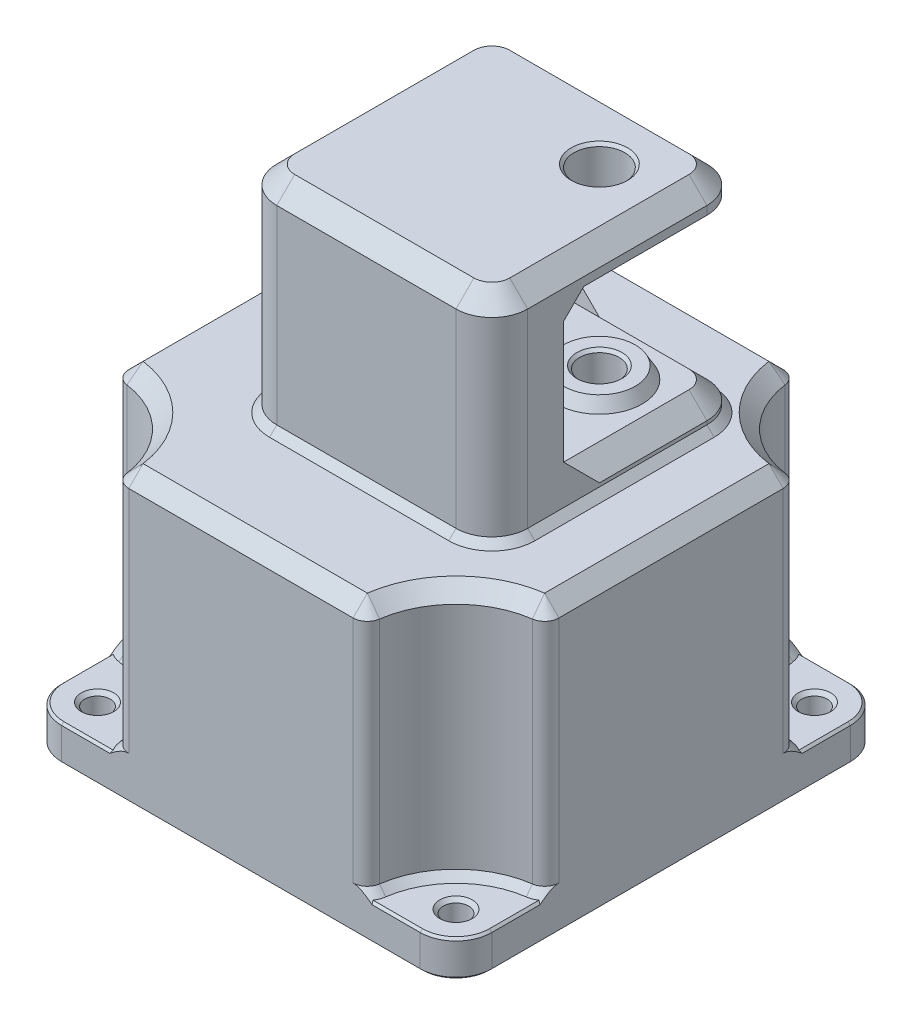
from build123d import *

# Parameters (mm, degrees)
BOSS_EXTRUDE1_DEPTH            = 6.35
BOSS_EXTRUDE7_DEPTH            = 50.8
SKETCH2_W                      = 44.45
SKETCH2_H                      = 44.45
BOSS_EXTRUDE2_DEPTH            = 55.88
BOSS_EXTRUDE3_DEPTH            = 83.82
BOSS_EXTRUDE4_START            = 83.82
SKETCH2_5_W                    = 31.75
SKETCH2_5_H                    = 31.75
SKETCH2_5_R                    = 6.35
BOSS_EXTRUDE4_DEPTH            = 5.08
BOSS_EXTRUDE6_START            = 81.699999938
SKETCH2_7_R                    = 6.35
BOSS_EXTRUDE6_DEPTH            = 2.120000062
BOSS_EXTRUDE6_DRAFT            = -30
F_8_CLEARANCE_HOLE1_AT_2_COUNT = 2
F_8_CLEARANCE_HOLE1_AT_2_PITCH = 63.5
F_8_CLEARANCE_HOLE1_AT_3_COUNT = 2
F_8_CLEARANCE_HOLE1_AT_3_PITCH = 89.802561211
F_8_CLEARANCE_HOLE1_AT_4_COUNT = 2
F_8_CLEARANCE_HOLE1_AT_4_PITCH = 63.5
FILLET2_R                      = 6.35
FILLET4_R                      = 2.54
CHAMFER2_SIZE                  = 3.175
CHAMFER3_SIZE                  = 3.175
CHAMFER5_SIZE                  = 1.27
CHAMFER6_SIZE                  = 2.54
CHAMFER7_SIZE                  = 1.27
CHAMFER4_SIZE                  = 0.396875


# Read off the part's stored shape, not the designer's step: Folder2___EndTag___
# Some blends are built 0.0001 mm under size
with BuildPart() as part:
    # Sketch1 → Boss-Extrude1 (new body)
    with BuildSketch(Plane(origin=(0, 0, 0), x_dir=(1, 0, 0), z_dir=(0, 1, 0))):
        with BuildLine():
            Line((-38.1, -22.225), (-38.1, -38.1))
            Line((-38.1, -38.1), (-22.225, -38.1))
            ThreePointArc((-22.225, -38.1), (-26.874679849, -26.874679849), (-38.1, -22.225))
        make_face()
        with BuildLine():
            ThreePointArc((-38.1, -22.225), (-26.874679849, -26.874679849), (-22.225, -38.1))
            Line((-22.225, -38.1), (22.225, -38.1))
            ThreePointArc((22.225, -38.1), (26.874679849, -26.874679849), (38.1, -22.225))
            Line((38.1, -22.225), (38.1, 22.225))
            ThreePointArc((38.1, 22.225), (26.874679849, 26.874679849), (22.225, 38.1))
            Line((22.225, 38.1), (-22.225, 38.1))
            ThreePointArc((-22.225, 38.1), (-26.874679849, 26.874679849), (-38.1, 22.225))
            Line((-38.1, 22.225), (-38.1, -22.225))
        make_face()
        with BuildLine():
            Line((-38.1, 38.1), (-38.1, 22.225))
            ThreePointArc((-38.1, 22.225), (-26.874679849, 26.874679849), (-22.225, 38.1))
            Line((-22.225, 38.1), (-38.1, 38.1))
        make_face()
        with BuildLine():
            ThreePointArc((22.225, 38.1), (26.874679849, 26.874679849), (38.1, 22.225))
            Line((38.1, 22.225), (38.1, 38.1))
            Line((38.1, 38.1), (22.225, 38.1))
        make_face()
        with BuildLine():
            ThreePointArc((38.1, -22.225), (26.874679849, -26.874679849), (22.225, -38.1))
            Line((22.225, -38.1), (38.1, -38.1))
            Line((38.1, -38.1), (38.1, -22.225))
        make_face()
    extrude(amount=BOSS_EXTRUDE1_DEPTH)

    # Sketch1<3> → Boss-Extrude7 (add)
    with BuildSketch(Plane(origin=(0, 0, 0), x_dir=(1, 0, 0), z_dir=(0, 1, 0))):
        with BuildLine():
            ThreePointArc((-38.1, -22.225), (-26.874679849, -26.874679849), (-22.225, -38.1))
            Line((-22.225, -38.1), (22.225, -38.1))
            ThreePointArc((22.225, -38.1), (26.874679849, -26.874679849), (38.1, -22.225))
            Line((38.1, -22.225), (38.1, 22.225))
            ThreePointArc((38.1, 22.225), (26.874679849, 26.874679849), (22.225, 38.1))
            Line((22.225, 38.1), (-22.225, 38.1))
            ThreePointArc((-22.225, 38.1), (-26.874679849, 26.874679849), (-38.1, 22.225))
            Line((-38.1, 22.225), (-38.1, -22.225))
        make_face()
    extrude(amount=BOSS_EXTRUDE7_DEPTH)

    # Sketch2 → Boss-Extrude2 (add)
    with BuildSketch(Plane(origin=(0, 0, 0), x_dir=(1, 0, 0), z_dir=(0, 1, 0))):
        with Locations((3.175, 3.175)):
            Rectangle(SKETCH2_W, SKETCH2_H)
    extrude(amount=BOSS_EXTRUDE2_DEPTH)

    # Sketch2<3> → Boss-Extrude3 (add)
    with BuildSketch(Plane(origin=(0, 0, 0), x_dir=(1, 0, 0), z_dir=(0, 1, 0))):
        Polygon((-19.05, 25.4), (-19.05, -19.05), (25.4, -19.05), (25.4, -6.35), (-6.35, -6.35), (-6.35, 25.4), align=None)
    extrude(amount=BOSS_EXTRUDE3_DEPTH)

    # Sketch2<5> → Boss-Extrude4 (add)
    # profile 1 of 3: a face of its own
    with BuildSketch(Plane(origin=(0, 0, 0), x_dir=(1, 0, 0), z_dir=(0, 1, 0)).offset(BOSS_EXTRUDE4_START)):
        Polygon((-19.05, 25.4), (-19.05, -19.05), (25.4, -19.05), (25.4, -6.35), (-6.35, -6.35), (-6.35, 25.4), align=None)
    # profile 2 of 3: a face of its own
    with BuildSketch(Plane(origin=(0, 0, 0), x_dir=(1, 0, 0), z_dir=(0, 1, 0)).offset(BOSS_EXTRUDE4_START)):
        with Locations((9.525, 9.525)):
            Rectangle(SKETCH2_5_W, SKETCH2_5_H)
        with Locations((12.7, 12.7)):
            Circle(SKETCH2_5_R, mode=Mode.SUBTRACT)
    # profile 3 of 3: a face of its own
    with BuildSketch(Plane(origin=(0, 0, 0), x_dir=(1, 0, 0), z_dir=(0, 1, 0)).offset(BOSS_EXTRUDE4_START)):
        with Locations((12.7, 12.7)):
            Circle(SKETCH2_5_R)
    extrude(amount=BOSS_EXTRUDE4_DEPTH)

    # Boss-Extrude5 outline → Boss-Extrude5 (revolve)
    with BuildSketch(Plane(origin=(12.7, 0, -12.7), x_dir=(1, 0, 0), z_dir=(0, 0, 1))):
        Polygon((6.35, 58.000000062), (0, 58.000000062), (0, 55.88), (7.573982606, 55.88), align=None)
    revolve(axis=Axis((12.7, 0, -12.7), (0, 1, 0)))


with BuildPart() as boss_extrude6_tool:
    # Sketch2<7> → Boss-Extrude6 (with draft: the straight prism first)
    with BuildSketch(Plane(origin=(0, 0, 0), x_dir=(1, 0, 0), z_dir=(0, 1, 0)).offset(BOSS_EXTRUDE6_START)):
        with Locations((12.7, 12.7)):
            Circle(SKETCH2_7_R)
    extrude(amount=BOSS_EXTRUDE6_DEPTH)
    # Boss-Extrude6: the draft: its side faces are tilted about the plane it starts from
    boss_extrude6_sides = [boss_extrude6_tool.faces().sort_by_distance(p)[0] for p in [
        (6.35, 82.759999969, -12.7),
    ]]
    draft(boss_extrude6_sides, Plane(origin=(0, 0, 0), x_dir=(1, 0, 0), z_dir=(0, 1, 0)).offset(BOSS_EXTRUDE6_START), BOSS_EXTRUDE6_DRAFT)


with BuildPart() as part_1:
    add(part.part)

    # Boss-Extrude6: add boss_extrude6_tool
    add(boss_extrude6_tool.part)

    # Sketch5 → Ø7.0 (7) Diameter Hole1 (revolve, cut)
    with BuildSketch(Plane(origin=(12.7, 58.000000062, -12.7), x_dir=(0, 0, 1), z_dir=(1, 0, 0))):
        Polygon((0, 0), (0, 58.000000062), (4, 58.000000062), (3.5, 57.500000062), (3.5, 0.5), (4, 0), align=None)
    revolve(axis=Axis((12.7, 64.350000062, -12.7), (0, -1, 0)), mode=Mode.SUBTRACT)

    # Sketch8 → M8 Clearance Hole1 (revolve, cut)
    with BuildSketch(Plane(origin=(12.7, 81.699999938, -12.7), x_dir=(0, 0, -1), z_dir=(1, 0, 0))):
        Polygon((0, 0), (0, 7.200000062), (5, 7.200000062), (4.5, 6.700000062), (4.5, 0.5), (5, 0), align=None)
    revolve(axis=Axis((12.7, 75.349999938, -12.7), (0, 1, 0)), mode=Mode.SUBTRACT)

    # Sketch17 → #8 Clearance Hole1 (revolve, cut)
    with BuildSketch(Plane(origin=(-31.75, 6.35, -31.75), x_dir=(0, 0, 1), z_dir=(1, 0, 0))):
        Polygon((0, 0), (0, 6.35), (2.8829, 6.35), (2.2479, 5.715), (2.2479, 0.635), (2.8829, 0), align=None)
    f_8_clearance_hole1 = revolve(axis=Axis((-31.75, 12.7, -31.75), (0, -1, 0)), mode=Mode.SUBTRACT)

    # #8 Clearance Hole1 at 2: #8 Clearance Hole1 ×2
    with Locations(*[(i * F_8_CLEARANCE_HOLE1_AT_2_PITCH, 0, 0) for i in range(1, F_8_CLEARANCE_HOLE1_AT_2_COUNT)]):
        add(f_8_clearance_hole1, mode=Mode.SUBTRACT)

    # #8 Clearance Hole1 at 3: #8 Clearance Hole1 ×2
    with Locations(*[Vector(0.7071067811865476, 0, 0.7071067811865476) * (i * F_8_CLEARANCE_HOLE1_AT_3_PITCH) for i in range(1, F_8_CLEARANCE_HOLE1_AT_3_COUNT)]):
        add(f_8_clearance_hole1, mode=Mode.SUBTRACT)

    # #8 Clearance Hole1 at 4: #8 Clearance Hole1 ×2
    with Locations(*[(0, 0, i * F_8_CLEARANCE_HOLE1_AT_4_PITCH) for i in range(1, F_8_CLEARANCE_HOLE1_AT_4_COUNT)]):
        add(f_8_clearance_hole1, mode=Mode.SUBTRACT)

    # Fillet2
    fillet2_edges = [part_1.edges().sort_by_distance(p)[0] for p in [
        (-6.35, 69.85, 6.35),
        (-38.1, 3.175, 38.1),
        (-38.1, 3.175, -38.1),
        (38.1, 3.175, -38.1),
        (38.1, 3.175, 38.1),
        (25.4, 86.36, -25.4),
        (25.4, 53.34, -25.4),
        (-19.05, 69.85, -25.4),
        (-19.05, 69.85, 19.05),
        (25.4, 69.85, 19.05),
    ]]
    fillet(fillet2_edges, radius=FILLET2_R)

    # Fillet4
    fillet4_edges = [part_1.edges().sort_by_distance(p)[0] for p in [
        (-22.225, 28.575, 38.1),
        (22.225, 28.575, 38.1),
        (38.1, 28.575, 22.225),
        (38.1, 28.575, -22.225),
        (22.225, 28.575, -38.1),
        (-22.225, 28.575, -38.1),
        (-38.1, 28.575, -22.225),
        (-38.1, 28.575, 22.225),
    ]]
    fillet(fillet4_edges, radius=FILLET4_R)

    # Chamfer2
    chamfer2_edges = [part_1.edges().sort_by_distance(p)[0] for p in [
        (-6.35, 83.82, -12.7),
        (12.7, 83.82, 6.35),
        (-6.35, 55.88, -12.7),
        (12.7, 55.88, 6.35),
        (-4.490128061, 55.88, 4.490128061),
        (-4.490128061, 83.82, 4.490128061),
    ]]
    chamfer(chamfer2_edges, length=CHAMFER2_SIZE)

    # Chamfer3
    chamfer3_edges = [part_1.edges().sort_by_distance(p)[0] for p in [
        (23.540128061, 55.88, -23.540128061),
        (3.175, 88.9, -25.4),
        (25.4, 88.9, -3.175),
        (-19.05, 88.9, -3.175),
        (3.175, 88.9, 19.05),
        (23.540128061, 88.9, 17.190128061),
        (-17.190128061, 88.9, 17.190128061),
        (-17.190128061, 88.9, -23.540128061),
        (23.540128061, 88.9, -23.540128061),
        (25.4, 55.88, -7.9375),
        (7.9375, 55.88, -25.4),
    ]]
    chamfer(chamfer3_edges, length=CHAMFER3_SIZE)

    # Chamfer5
    chamfer5_edges = [part_1.edges().sort_by_distance(p)[0] for p in [
        (3.175, 50.8, -25.4),
        (25.4, 50.8, -3.175),
        (-19.05, 50.8, -3.175),
        (3.175, 50.8, 19.05),
        (-17.190128061, 50.8, -23.540128061),
        (23.540128061, 50.8, -23.540128061),
        (-17.190128061, 50.8, 17.190128061),
        (23.540128061, 50.8, 17.190128061),
    ]]
    chamfer(chamfer5_edges, length=CHAMFER5_SIZE)

    # Chamfer6
    chamfer6_edges = [part_1.edges().sort_by_distance(p)[0] for p in [
        (-38.1, 50.8, 0),
        (-26.874679849, 50.8, -26.874679849),
        (0, 50.8, 38.1),
        (26.874679849, 50.8, 26.874679849),
        (38.1, 50.8, 0),
        (26.874679849, 50.8, -26.874679849),
        (0, 50.8, -38.1),
        (-26.874679849, 50.8, 26.874679849),
        (21.528605295, 50.8, 37.475916995),
        (37.475916995, 50.8, 21.528605295),
        (37.475916995, 50.8, -21.528605295),
        (21.528605295, 50.8, -37.475916995),
        (-21.528605295, 50.8, 37.475916995),
        (-37.475916995, 50.8, 21.528605295),
        (-21.528605295, 50.8, -37.475916995),
        (-37.475916995, 50.8, -21.528605295),
    ]]
    chamfer(chamfer6_edges, length=CHAMFER6_SIZE - 0.0001)  # a hair under: the kernel refuses the full size

    # Chamfer7
    # the kernel refuses this chamfer: 1.27 mm, written as the material it adds along each edge
    with BuildSketch(Plane(origin=(-38.1, 6.35, -38.1), x_dir=(0.9904418356100051, 0, 0.1379310344827576), z_dir=(0.1379310344827576, 0, -0.9904418356100051))) as chamfer7_piece_1:
        Polygon((15.875, -CHAMFER7_SIZE), (15.875 - CHAMFER7_SIZE, 0), (15.875, 0), align=None)
    revolve(axis=Axis((-38.1, 6.35, -38.1), (0, -1, 0)), revolution_arc=74.143716468)
    with BuildSketch(Plane(origin=(-38.1, 6.35, 38.1), x_dir=(0.13793103448275934, 0, -0.9904418356100048), z_dir=(-0.9904418356100048, 0, -0.13793103448275934))) as chamfer7_piece_2:
        Polygon((15.875, -CHAMFER7_SIZE), (15.875 - CHAMFER7_SIZE, 0), (15.875, 0), align=None)
    revolve(axis=Axis((-38.1, 6.35, 38.1), (0, -1, 0)), revolution_arc=74.143716468)
    with BuildSketch(Plane(origin=(38.1, 6.35, -38.1), x_dir=(-0.13793103448275804, 0, 0.990441835610005), z_dir=(0.990441835610005, 0, 0.13793103448275804))) as chamfer7_piece_3:
        Polygon((15.875, -CHAMFER7_SIZE), (15.875 - CHAMFER7_SIZE, 0), (15.875, 0), align=None)
    revolve(axis=Axis((38.1, 6.35, -38.1), (0, -1, 0)), revolution_arc=74.143716468)
    with BuildSketch(Plane(origin=(38.1, 6.35, 38.1), x_dir=(-0.9904418356100045, 0, -0.13793103448276064), z_dir=(-0.13793103448276064, 0, 0.9904418356100045))) as chamfer7_piece_4:
        Polygon((15.875, -CHAMFER7_SIZE), (15.875 - CHAMFER7_SIZE, 0), (15.875, 0), align=None)
    revolve(axis=Axis((38.1, 6.35, 38.1), (0, -1, 0)), revolution_arc=74.143716468)
    with BuildSketch(Plane(origin=(-35.56, 6.35, -19.861013597), x_dir=(-0.28070188278331787, 0, 0.9597950057183569), z_dir=(0.9597950057183569, 0, 0.28070188278331787))) as chamfer7_piece_5_section:
        Polygon((2.54, -CHAMFER7_SIZE), (2.54 + CHAMFER7_SIZE, 0), (2.54, 0), align=None)
    chamfer7_piece_5 = revolve(axis=Axis((-35.56, 6.35, -19.861013597), (0, -1, 0)), revolution_arc=155.769758511, mode=Mode.PRIVATE)
    chamfer7_piece_5 = split(chamfer7_piece_5, bisect_by=Plane(origin=(-38.1, 6.867943866, -21.668260247), z_dir=(1, 0, 0)), keep=Keep.TOP, mode=Mode.PRIVATE)
    add(chamfer7_piece_5)
    with BuildSketch(Plane(origin=(-19.861013597, 6.35, -35.56), x_dir=(-0.9904418356100047, 0, -0.1379310344827609), z_dir=(-0.1379310344827609, 0, 0.9904418356100047))) as chamfer7_piece_6_section:
        Polygon((2.54, -CHAMFER7_SIZE), (2.54 + CHAMFER7_SIZE, 0), (2.54, 0), align=None)
    chamfer7_piece_6 = revolve(axis=Axis((-19.861013597, 6.35, -35.56), (0, -1, 0)), revolution_arc=155.769758511, mode=Mode.PRIVATE)
    chamfer7_piece_6 = split(chamfer7_piece_6, bisect_by=Plane(origin=(-21.668259491, 6.867943351, -38.1), z_dir=(0, 0, 1)), keep=Keep.TOP, mode=Mode.PRIVATE)
    add(chamfer7_piece_6)
    with BuildSketch(Plane(origin=(-35.56, 6.35, 19.861013597), x_dir=(-0.28070188278331787, 0, -0.9597950057183569), z_dir=(0.9597950057183569, 0, -0.28070188278331787))) as chamfer7_piece_7_section:
        Polygon((2.54, CHAMFER7_SIZE), (2.54 + CHAMFER7_SIZE, 0), (2.54, 0), align=None)
    chamfer7_piece_7 = revolve(axis=Axis((-35.56, 6.35, 19.861013597), (0, 1, 0)), revolution_arc=155.769758511, mode=Mode.PRIVATE)
    chamfer7_piece_7 = split(chamfer7_piece_7, bisect_by=Plane(origin=(-38.1, 6.867944302, 21.668259037), z_dir=(1, 0, 0)), keep=Keep.TOP, mode=Mode.PRIVATE)
    add(chamfer7_piece_7)
    with BuildSketch(Plane(origin=(-19.861013597, 6.35, 35.56), x_dir=(-0.9904418356100043, 0, 0.13793103448276364), z_dir=(-0.13793103448276364, 0, -0.9904418356100043))) as chamfer7_piece_8_section:
        Polygon((2.54, CHAMFER7_SIZE), (2.54 + CHAMFER7_SIZE, 0), (2.54, 0), align=None)
    chamfer7_piece_8 = revolve(axis=Axis((-19.861013597, 6.35, 35.56), (0, 1, 0)), revolution_arc=155.769758511, mode=Mode.PRIVATE)
    chamfer7_piece_8 = split(chamfer7_piece_8, bisect_by=Plane(origin=(-21.668260079, 6.867943912, 38.1), z_dir=(0, 0, -1)), keep=Keep.TOP, mode=Mode.PRIVATE)
    add(chamfer7_piece_8)
    with BuildSketch(Plane(origin=(19.861013597, 6.35, -35.56), x_dir=(-0.9597950057183566, 0, -0.2807018827833178), z_dir=(-0.2807018827833178, 0, 0.9597950057183566))) as chamfer7_piece_9_section:
        Polygon((2.54, -CHAMFER7_SIZE), (2.54 + CHAMFER7_SIZE, 0), (2.54, 0), align=None)
    chamfer7_piece_9 = revolve(axis=Axis((19.861013597, 6.35, -35.56), (0, -1, 0)), revolution_arc=155.769758511, mode=Mode.PRIVATE)
    chamfer7_piece_9 = split(chamfer7_piece_9, bisect_by=Plane(origin=(21.668260247, 6.867943866, -38.1), z_dir=(0, 0, 1)), keep=Keep.TOP, mode=Mode.PRIVATE)
    add(chamfer7_piece_9)
    with BuildSketch(Plane(origin=(35.56, 6.35, -19.861013597), x_dir=(0.2807018827833123, 0, 0.9597950057183584), z_dir=(-0.9597950057183584, 0, 0.2807018827833123))) as chamfer7_piece_10_section:
        Polygon((2.54, CHAMFER7_SIZE), (2.54 + CHAMFER7_SIZE, 0), (2.54, 0), align=None)
    chamfer7_piece_10 = revolve(axis=Axis((35.56, 6.35, -19.861013597), (0, 1, 0)), revolution_arc=155.769758511, mode=Mode.PRIVATE)
    chamfer7_piece_10 = split(chamfer7_piece_10, bisect_by=Plane(origin=(38.1, 6.867944302, -21.668259037), z_dir=(-1, 0, 0)), keep=Keep.TOP, mode=Mode.PRIVATE)
    add(chamfer7_piece_10)
    with BuildSketch(Plane(origin=(35.56, 6.35, 19.861013597), x_dir=(0.28070188278331787, 0, -0.9597950057183569), z_dir=(-0.9597950057183569, 0, -0.28070188278331787))) as chamfer7_piece_11_section:
        Polygon((2.54, -CHAMFER7_SIZE), (2.54 + CHAMFER7_SIZE, 0), (2.54, 0), align=None)
    chamfer7_piece_11 = revolve(axis=Axis((35.56, 6.35, 19.861013597), (0, -1, 0)), revolution_arc=155.769758511, mode=Mode.PRIVATE)
    chamfer7_piece_11 = split(chamfer7_piece_11, bisect_by=Plane(origin=(38.1, 6.867943866, 21.668260247), z_dir=(-1, 0, 0)), keep=Keep.TOP, mode=Mode.PRIVATE)
    add(chamfer7_piece_11)
    with BuildSketch(Plane(origin=(19.861013597, 6.35, 35.56), x_dir=(-0.9597950057183577, 0, 0.28070188278331487), z_dir=(-0.28070188278331487, 0, -0.9597950057183577))) as chamfer7_piece_12_section:
        Polygon((2.54, CHAMFER7_SIZE), (2.54 + CHAMFER7_SIZE, 0), (2.54, 0), align=None)
    chamfer7_piece_12 = revolve(axis=Axis((19.861013597, 6.35, 35.56), (0, 1, 0)), revolution_arc=155.769758511, mode=Mode.PRIVATE)
    chamfer7_piece_12 = split(chamfer7_piece_12, bisect_by=Plane(origin=(21.668259037, 6.867944302, 38.1), z_dir=(0, 0, -1)), keep=Keep.TOP, mode=Mode.PRIVATE)
    add(chamfer7_piece_12)

    # Chamfer4
    chamfer4_edges = [part_1.edges().sort_by_distance(p)[0] for p in [
        (7.9375, 83.82, -25.4),
        (25.4, 83.82, -7.9375),
        (23.540128061, 83.82, -23.540128061),
        (-38.1, 0, 0),
        (-38.1, 6.35, 27.225409964),
        (0, 0, -38.1),
        (38.1, 0, 0),
        (0, 0, 38.1),
        (36.240128061, 0, -36.240128061),
        (36.240128061, 0, 36.240128061),
        (-36.240128061, 0, 36.240128061),
        (-36.240128061, 0, -36.240128061),
        (-27.225409964, 6.35, -38.1),
        (-36.240128061, 6.35, -36.240128061),
        (-27.225409964, 6.35, 38.1),
        (-36.240128061, 6.35, 36.240128061),
        (38.1, 6.35, 27.225409964),
        (36.240128061, 6.35, 36.240128061),
        (36.240128061, 6.35, -36.240128061),
        (27.225409964, 6.35, 38.1),
        (38.1, 6.35, -27.225409964),
        (27.225409964, 6.35, -38.1),
        (-38.1, 6.35, -27.225409964),
    ]]
    chamfer(chamfer4_edges, length=CHAMFER4_SIZE)


solid = part_1.part
